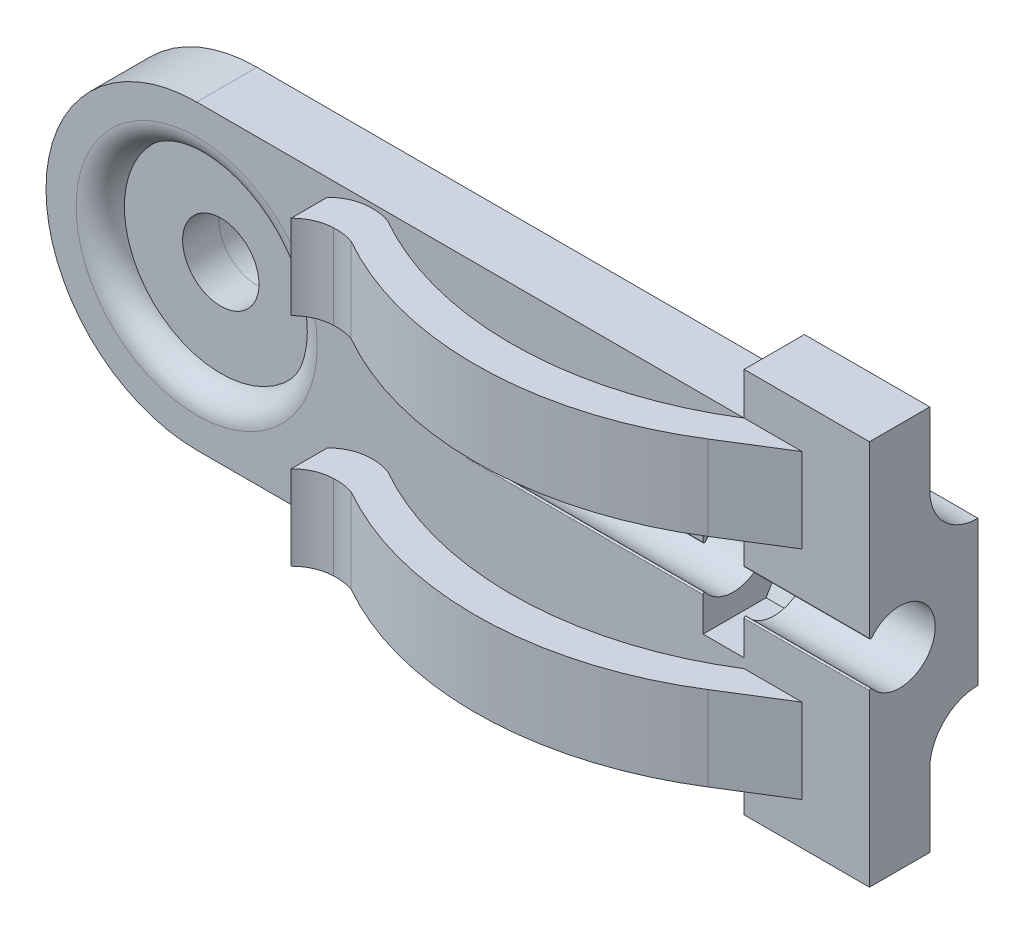
from build123d import *

# Parameters (mm, degrees)
SKETCH1_R           = 1.5825
SKETCH1_W           = 10
SKETCH1_H           = 12.5
BOSS_EXTRUDE1_DEPTH = 2.5
SKETCH2_W           = 5.2
SKETCH2_H           = 16
BOSS_EXTRUDE2_DEPTH = 2.5
SKETCH3_W           = 1.7
SKETCH3_H           = 4.72
CUT_EXTRUDE1_DEPTH  = 30.1317696
BOSS_EXTRUDE3_DEPTH = 3.5
BOSS_EXTRUDE5_DEPTH = 3.5
SKETCH10_R          = 4
BOSS_EXTRUDE6_DEPTH = 1.875
SKETCH11_R          = 1.585
CUT_EXTRUDE4_DEPTH  = 30.669560778
SKETCH12_R          = 4
CUT_EXTRUDE5_DEPTH  = 1
FILLET1_R           = 1
FILLET2_R           = 1
SKETCH14_W          = 11.670795551
SKETCH14_H          = 6
BOSS_EXTRUDE7_DEPTH = 2
SKETCH6_R           = 1.475
CUT_EXTRUDE3_DEPTH  = 16.7
CUT_EXTRUDE8_DEPTH  = 1.7
FILLET3_R           = 2
FILLET4_R           = 0.05


with BuildPart() as part:
    # Sketch1 → Boss-Extrude1 (new body)
    # profile 1 of 2: a face of its own
    with BuildSketch(Plane.XY):
        with BuildLine():
            ThreePointArc((0, 6.25), (-6.25, 0), (0, -6.25))
            Line((0, -6.25), (12.7, -6.25))
            Line((12.7, -6.25), (12.7, 6.25))
            Line((12.7, 6.25), (0, 6.25))
        make_face()
        Circle(SKETCH1_R, mode=Mode.SUBTRACT)
    # profile 2 of 2: a face of its own
    with BuildSketch(Plane.XY):
        with Locations((17.7, 0)):
            Rectangle(SKETCH1_W, SKETCH1_H)
    extrude(amount=BOSS_EXTRUDE1_DEPTH)

    # Sketch2 → Boss-Extrude2 (add)
    with BuildSketch(Plane.XY.offset(2.5)):
        with Locations((25.3, 0)):
            Rectangle(SKETCH2_W, SKETCH2_H)
    extrude(amount=-BOSS_EXTRUDE2_DEPTH)

    # Sketch3 → Cut-Extrude1 (cut, through all)
    with BuildSketch(Plane.XY.offset(2.5)):
        with Locations((21.85, 0)):
            Rectangle(SKETCH3_W, SKETCH3_H)
    extrude(amount=-CUT_EXTRUDE1_DEPTH, mode=Mode.SUBTRACT)


with BuildPart() as body_2:
    # Sketch7 → Boss-Extrude3 (new body)
    with BuildSketch(Plane.XZ.offset(6.25)):
        with BuildLine():
            Line((6.129900512, 3.210673711), (6.129900512, 4.710673711))
            ThreePointArc((6.129900512, 4.710673711), (6.694341527, 4.327552018), (7.360579964, 4.180915603))
            ThreePointArc((7.360579964, 4.180915603), (7.789326283, 4.199870579), (8.206709695, 4.299739418))
            ThreePointArc((8.206709695, 4.299739418), (15.494742209, 6.151071465), (22.7, 4))
            Line((22.7, 4), (22.7, 2.5))
            ThreePointArc((22.7, 2.5), (15.494742209, 4.651071465), (8.206709695, 2.799739418))
            ThreePointArc((8.206709695, 2.799739418), (7.789326283, 2.699870579), (7.360579964, 2.680915603))
            ThreePointArc((7.360579964, 2.680915603), (6.694341527, 2.827552018), (6.129900512, 3.210673711))
        make_face()
    extrude(amount=-BOSS_EXTRUDE3_DEPTH)


with BuildPart() as body_3:
    # Sketch9 → Boss-Extrude5 (new body)
    with BuildSketch(Plane.XZ.offset(6.25)):
        Polygon((22.7, 4), (25.104907101, 2.5), (22.7, 2.5), align=None)
    extrude(amount=-BOSS_EXTRUDE5_DEPTH)

    # Combine1: union body 2
    add(body_2.part)


with BuildPart() as body_3_2:
    # Mirror5: mirrored copy
    add(body_3.part.mirror(Plane(origin=(0, 0, 0), x_dir=(0, 0, 1), z_dir=(0, -1, 0))))


with BuildPart() as part_1:
    add(part.part)

    # Combine4: union body 3, body 3 2
    add(body_3.part)
    add(body_3_2.part)

    # Sketch10 → Boss-Extrude6 (add)
    with BuildSketch(Plane(origin=(0, 0, 0), x_dir=(-1, 0, 0), z_dir=(0, 0, -1))):
        with Locations(Location((0, 0, 0), (0, 0, 180))):
            Circle(SKETCH10_R)
    extrude(amount=BOSS_EXTRUDE6_DEPTH)

    # Sketch11 → Cut-Extrude4 (cut, through all)
    with BuildSketch(Plane.XY):
        Circle(SKETCH11_R)
    extrude(amount=-CUT_EXTRUDE4_DEPTH, mode=Mode.SUBTRACT)

    # Sketch12 → Cut-Extrude5 (cut)
    with BuildSketch(Plane.XY.offset(2.5)):
        Circle(SKETCH12_R)
    extrude(amount=-CUT_EXTRUDE5_DEPTH, mode=Mode.SUBTRACT)

    # Fillet1
    fillet1_edges = [part_1.edges().sort_by_distance(p)[0] for p in [
        (-4, 0, 2.5),
    ]]
    fillet(fillet1_edges, radius=FILLET1_R - 0.0001)  # a hair under: the kernel refuses the full size

    # Fillet2
    fillet2_edges = [part_1.edges().sort_by_distance(p)[0] for p in [
        (-4, 0, -1.875),
    ]]
    fillet(fillet2_edges, radius=FILLET2_R)

    # Sketch14 → Boss-Extrude7 (add)
    with BuildSketch(Plane(origin=(0, 0, 0), x_dir=(-1, 0, 0), z_dir=(0, 0, -1))):
        with Locations((-22.064602224, 0)):
            Rectangle(SKETCH14_W, SKETCH14_H)
    extrude(amount=BOSS_EXTRUDE7_DEPTH)

    # Sketch6 → Cut-Extrude3 (cut)
    with BuildSketch(Plane(origin=(27.9, 0, 0), x_dir=(0, 0, -1), z_dir=(1, 0, 0))):
        with Locations((-1.25, 0)):
            Circle(SKETCH6_R)
    extrude(amount=-CUT_EXTRUDE3_DEPTH, mode=Mode.SUBTRACT)

    # Sketch16 → Cut-Extrude8 (cut)
    with BuildSketch(Plane(origin=(21, 0, 0), x_dir=(0, 0, -1), z_dir=(1, 0, 0))):
        Polygon((1.475093271, 0), (0.112546635, 2.36), (-2.612546635, 2.36), (-3.975093271, 0), (-2.612546635, -2.36), (0.112546635, -2.36), align=None)
    extrude(amount=CUT_EXTRUDE8_DEPTH, mode=Mode.SUBTRACT)

    # Fillet3
    fillet3_edges = [part_1.edges().sort_by_distance(p)[0] for p in [
        (22.064602225, -3, 0),
        (22.064602225, 3, 0),
    ]]
    fillet(fillet3_edges, radius=FILLET3_R - 0.0001)  # a hair under: the kernel refuses the full size

    # Fillet4
    fillet4_edges = [part_1.edges().sort_by_distance(p)[0] for p in [
        (16.1, -0.783022988, 2.5),
        (25.3, -0.783022988, 2.5),
        (25.3, 0.783022988, 2.5),
        (16.1, 0.783022988, 2.5),
        (13.714602225, -0.783022988, 0),
        (13.714602225, 0.783022988, 0),
    ]]
    fillet(fillet4_edges, radius=FILLET4_R)


solid = part_1.part
